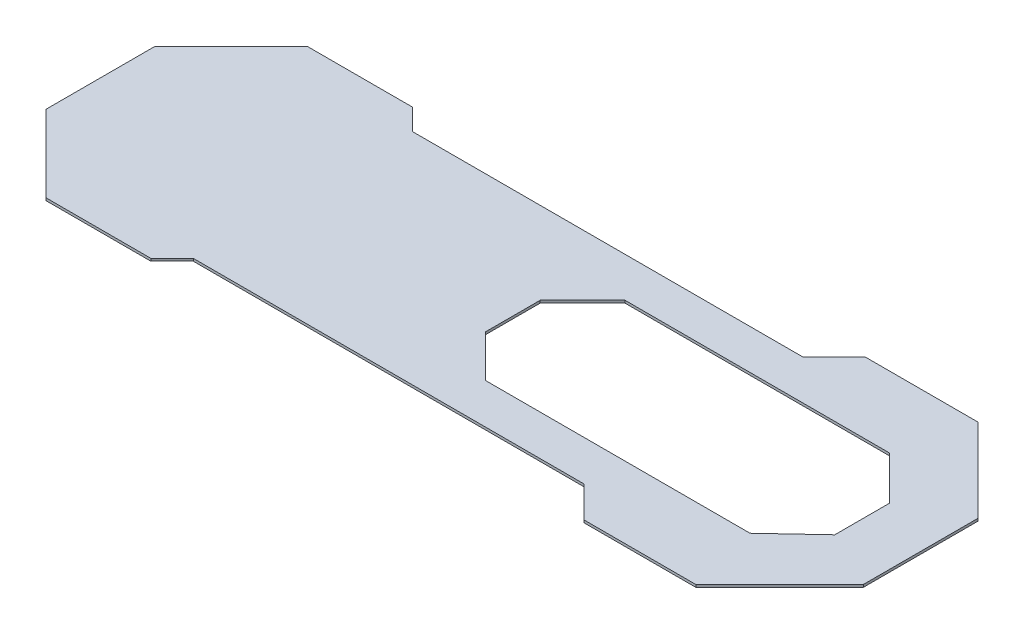
from build123d import *

# Parameters (mm, degrees)
SM_BASE_FLANGE_1_DEPTH = 1
CUT_EXTRUDE_1_DEPTH    = 10


# Sheet-metal steps are written as plain solids
with BuildPart() as part:
    # Sketch 1 → Базовая кромка1 (new body)
    with BuildSketch(Plane(origin=(0, 0, 0), x_dir=(1, 0, 0), z_dir=(0, 1, 0))):
        Polygon((-57.720952925, -161.889640506), (-213.157461064, -161.889640506), (-213.778781408, -161.889640506), (-214.218121236, -161.450300678), (-222.278781408, -153.389640506), (-264.356991895, -153.389640506), (-295.11077987, -184.143428482), (-295.11077987, -227.635852531), (-264.356991895, -258.389640506), (-222.278781408, -258.389640506), (-214.218121236, -250.328980334), (-213.778781408, -249.889640506), (-213.157461064, -249.889640506), (-57.720952925, -249.889640506), (-57.099632582, -249.889640506), (-56.660292754, -250.328980334), (-44.599632582, -262.389640506), (0.278072842, -262.389640506), (33.88922013, -228.778493218), (33.88922013, -182.800787794), (0.478072842, -149.389640506), (-44.599632582, -149.389640506), (-56.660292754, -161.450300678), (-57.099632582, -161.889640506), align=None)
    extrude(amount=-SM_BASE_FLANGE_1_DEPTH)

    # Эскиз3 → Вырез-Вытянуть1 (cut)
    with BuildSketch(Plane(origin=(0, 0, 0), x_dir=(1, 0, 0), z_dir=(0, 1, 0))):
        Polygon((-129.650630124, -194.854768426), (-112.66234875, -177.866487052), (-6.632911498, -177.866487052), (10.895241956, -195.394640506), (10.895241956, -217.265248922), (-6.633389706, -233.712753004), (-112.662389706, -233.712753004), (-129.650630124, -216.724512586), align=None)
    extrude(amount=-CUT_EXTRUDE_1_DEPTH, mode=Mode.SUBTRACT)


solid = part.part
